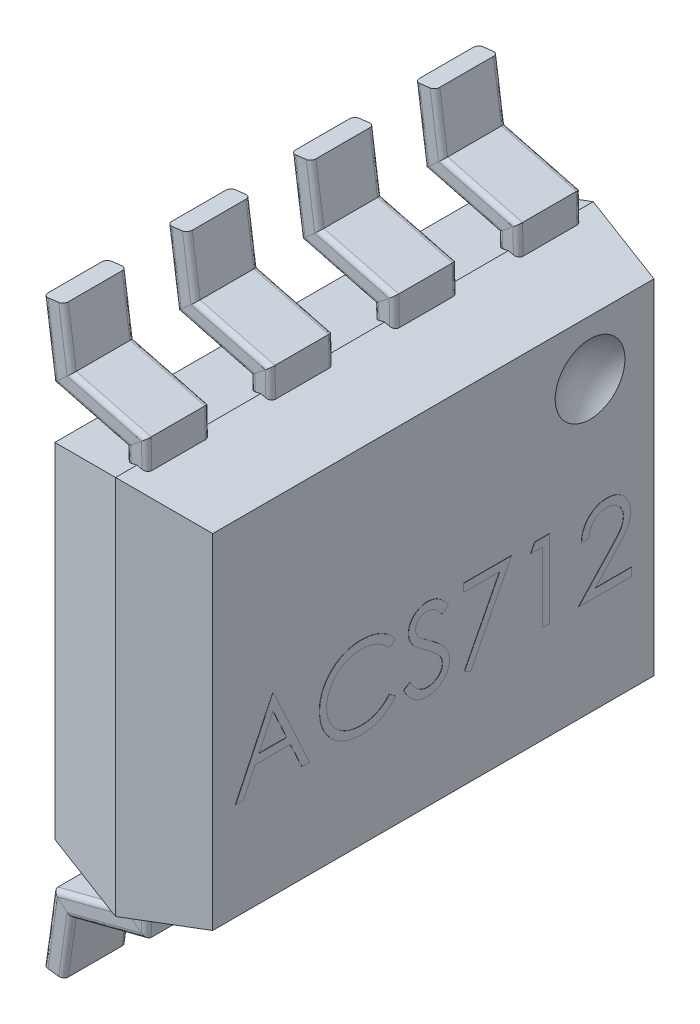
from build123d import *

# Parameters (mm, degrees)
SKETCH1_W                     = 4.9
SKETCH1_H                     = 3.9
BOSS_EXTRUDE1_DEPTH           = 0.81
BOSS_EXTRUDE1_TAPER           = 13
BOSS_EXTRUDE1_OTHER_WAY_DEPTH = 0.81
BOSS_EXTRUDE1_OTHER_WAY_TAPER = 13
LPATTERN1_COUNT               = 4
LPATTERN1_PITCH               = 1.27
BOSS_EXTRUDE2_DEPTH           = 0.0025


with BuildPart() as part:
    # Sketch1 → Boss-Extrude1 (new body)
    with BuildSketch(Plane(origin=(0, 0, 0), x_dir=(0, 0, -1), z_dir=(1, 0, 0))):
        Rectangle(SKETCH1_W, SKETCH1_H)
    extrude(amount=BOSS_EXTRUDE1_DEPTH, taper=BOSS_EXTRUDE1_TAPER)

    # Sketch1 → Boss-Extrude1 other way (add)
    with BuildSketch(Plane(origin=(0, 0, 0), x_dir=(0, 0, -1), z_dir=(1, 0, 0))):
        Rectangle(SKETCH1_W, SKETCH1_H)
    extrude(amount=-BOSS_EXTRUDE1_OTHER_WAY_DEPTH, taper=BOSS_EXTRUDE1_OTHER_WAY_TAPER)

    # Sweep1: sweep along a path in Sketch3
    with BuildLine(Plane.XY.offset(1.91)) as sweep1_path:
        Line((0.007954045, -1.762996765), (0, -2.147914592))
        Line((0, -2.147914592), (-0.759438706, -2.343537501))
        Line((-0.759438706, -2.343537501), (-0.85, -2.987914592))
    # Sketch2 → Sweep1 (sweep)
    with BuildSketch(Plane(origin=(0, -1.762996765, 0), x_dir=(-1, 0, 0), z_dir=(0, -1, 0))):
        with BuildLine():
            Line((0.055, -2.23), (-0.055, -2.23))
            ThreePointArc((-0.055, -2.23), (-0.090355339, -2.215355339), (-0.105, -2.18))
            Line((-0.105, -2.18), (-0.105, -1.63))
            ThreePointArc((-0.105, -1.63), (-0.090355339, -1.594644661), (-0.055, -1.58))
            Line((-0.055, -1.58), (0.055, -1.58))
            ThreePointArc((0.055, -1.58), (0.090355339, -1.594644661), (0.105, -1.63))
            Line((0.105, -1.63), (0.105, -2.18))
            ThreePointArc((0.105, -2.18), (0.090355339, -2.215355339), (0.055, -2.23))
        make_face()
    sweep1 = sweep(path=sweep1_path.line, transition=Transition.RIGHT)

    # LPattern1: Sweep1 ×4
    with Locations(*[(0, 0, -i * LPATTERN1_PITCH) for i in range(1, LPATTERN1_COUNT)]):
        add(sweep1)

    # Mirror1: Sweep1 across plane
    add(sweep1.mirror(Plane.ZX))

    # Mirror1 copy 1: sweep along a path in Mirror1 copy 1 path
    with BuildLine(Plane.XY.offset(0.64)) as mirror1_copy_1_path:
        Line((0.007954045, 1.762996765), (0, 2.147914592))
        Line((0, 2.147914592), (-0.759438706, 2.343537501))
        Line((-0.759438706, 2.343537501), (-0.85, 2.987914592))
    # Mirror1 copy 1 sketch → Mirror1 copy 1 (sweep)
    with BuildSketch(Plane(origin=(0, 1.762996765, -1.27), x_dir=(-1, 0, 0), z_dir=(0, 1, 0))):
        with BuildLine():
            Line((0.055, 2.23), (-0.055, 2.23))
            ThreePointArc((-0.055, 2.23), (-0.090355339, 2.215355339), (-0.105, 2.18))
            Line((-0.105, 2.18), (-0.105, 1.63))
            ThreePointArc((-0.105, 1.63), (-0.090355339, 1.594644661), (-0.055, 1.58))
            Line((-0.055, 1.58), (0.055, 1.58))
            ThreePointArc((0.055, 1.58), (0.090355339, 1.594644661), (0.105, 1.63))
            Line((0.105, 1.63), (0.105, 2.18))
            ThreePointArc((0.105, 2.18), (0.090355339, 2.215355339), (0.055, 2.23))
        make_face()
    sweep(path=mirror1_copy_1_path.line, transition=Transition.RIGHT)

    # Mirror1 copy 2: sweep along a path in Mirror1 copy 2 path
    with BuildLine(Plane.XY.offset(-0.63)) as mirror1_copy_2_path:
        Line((0.007954045, 1.762996765), (0, 2.147914592))
        Line((0, 2.147914592), (-0.759438706, 2.343537501))
        Line((-0.759438706, 2.343537501), (-0.85, 2.987914592))
    # Mirror1 copy 2 sketch → Mirror1 copy 2 (sweep)
    with BuildSketch(Plane(origin=(0, 1.762996765, -2.54), x_dir=(-1, 0, 0), z_dir=(0, 1, 0))):
        with BuildLine():
            Line((0.055, 2.23), (-0.055, 2.23))
            ThreePointArc((-0.055, 2.23), (-0.090355339, 2.215355339), (-0.105, 2.18))
            Line((-0.105, 2.18), (-0.105, 1.63))
            ThreePointArc((-0.105, 1.63), (-0.090355339, 1.594644661), (-0.055, 1.58))
            Line((-0.055, 1.58), (0.055, 1.58))
            ThreePointArc((0.055, 1.58), (0.090355339, 1.594644661), (0.105, 1.63))
            Line((0.105, 1.63), (0.105, 2.18))
            ThreePointArc((0.105, 2.18), (0.090355339, 2.215355339), (0.055, 2.23))
        make_face()
    sweep(path=mirror1_copy_2_path.line, transition=Transition.RIGHT)

    # Mirror1 copy 3: sweep along a path in Mirror1 copy 3 path
    with BuildLine(Plane.XY.offset(-1.9)) as mirror1_copy_3_path:
        Line((0.007954045, 1.762996765), (0, 2.147914592))
        Line((0, 2.147914592), (-0.759438706, 2.343537501))
        Line((-0.759438706, 2.343537501), (-0.85, 2.987914592))
    # Mirror1 copy 3 sketch → Mirror1 copy 3 (sweep)
    with BuildSketch(Plane(origin=(0, 1.762996765, -3.81), x_dir=(-1, 0, 0), z_dir=(0, 1, 0))):
        with BuildLine():
            Line((0.055, 2.23), (-0.055, 2.23))
            ThreePointArc((-0.055, 2.23), (-0.090355339, 2.215355339), (-0.105, 2.18))
            Line((-0.105, 2.18), (-0.105, 1.63))
            ThreePointArc((-0.105, 1.63), (-0.090355339, 1.594644661), (-0.055, 1.58))
            Line((-0.055, 1.58), (0.055, 1.58))
            ThreePointArc((0.055, 1.58), (0.090355339, 1.594644661), (0.105, 1.63))
            Line((0.105, 1.63), (0.105, 2.18))
            ThreePointArc((0.105, 2.18), (0.090355339, 2.215355339), (0.055, 2.23))
        make_face()
    sweep(path=mirror1_copy_3_path.line, transition=Transition.RIGHT)

    # Sketch12 → Cut-Revolve1 (revolve, cut)
    with BuildSketch(Plane(origin=(0, 1.2, 0), x_dir=(1, 0, 0), z_dir=(0, 1, 0))):
        with BuildLine():
            Line((0.81, 1.96553499), (0.857828021, 1.96553499))
            Line((0.857828021, 1.96553499), (0.857828021, 1.607656851))
            Line((0.857828021, 1.607656851), (0.661762021, 1.607656851))
            ThreePointArc((0.661762021, 1.607656851), (0.701899104, 1.800671687), (0.81, 1.96553499))
        make_face()
    revolve(axis=Axis((0.905576276, 1.2, -1.607656851), (-1, 0, 0)), mode=Mode.SUBTRACT)

    # Sketch14 → Boss-Extrude2 (add)
    # profile 1 of 6: a face of its own
    with BuildSketch(Plane(origin=(0.81, 0, 0), x_dir=(0, 0, -1), z_dir=(1, 0, 0))):
        Polygon((-1.641025641, 0.037003235), (-1.271794872, -0.762996765), (-1.349839744, -0.762996765), (-1.468108974, -0.506586509), (-1.830769231, -0.506586509), (-1.952403846, -0.762996765), (-2.030769231, -0.762996765), (-1.651282051, 0.037003235), align=None)
        Polygon((-1.646955128, -0.118926252), (-1.791826923, -0.424535227), (-1.505929487, -0.424535227), align=None, mode=Mode.SUBTRACT)
    # profile 2 of 6: a face of its own
    with BuildSketch(Plane(origin=(0.81, 0, 0), x_dir=(0, 0, -1), z_dir=(1, 0, 0))):
        with BuildLine():
            Line((-0.38974359, -0.109791637), (-0.452564103, -0.15786856))
            add(Edge.make_bspline(
                [(-0.452564103, -0.15786856), (-0.457045448, -0.152527767), (-0.465947722, -0.141918186), (-0.480269825, -0.127020005), (-0.495195915, -0.113062231), (-0.510720286, -0.099978372), (-0.52712237, -0.088225969), (-0.544004839, -0.077192574), (-0.561650106, -0.067302805), (-0.586050503, -0.055311265), (-0.617970011, -0.042797859), (-0.658151688, -0.032305691), (-0.700097082, -0.025626566), (-0.728713676, -0.024903173), (-0.743269231, -0.024535227)],
                knots=[0, 0, 0, 0, 0.757959112, 1.505699292, 2.245454638, 2.979532153, 3.711538275, 4.438200793, 5.171680507, 5.909471876, 7.393775596, 8.890124382, 10.418191784, 12, 12, 12, 12], degree=3))
            add(Edge.make_bspline(
                [(-0.743269231, -0.024535227), (-0.751288271, -0.024627561), (-0.767251926, -0.024811373), (-0.790943006, -0.027236316), (-0.814191703, -0.030644592), (-0.836982895, -0.035701809), (-0.859287572, -0.04209555), (-0.881251549, -0.049735645), (-0.902556829, -0.05918818), (-0.923498141, -0.069635782), (-0.94356196, -0.081436341), (-0.962545971, -0.094307964), (-0.980380935, -0.108106615), (-0.997080961, -0.122884011), (-1.012663121, -0.138573601), (-1.027014506, -0.155342594), (-1.040085457, -0.173137376), (-1.052135063, -0.191723298), (-1.062926545, -0.211046222), (-1.071961946, -0.231177667), (-1.079963116, -0.25177289), (-1.086294372, -0.273064584), (-1.09130569, -0.294902931), (-1.094763442, -0.317346539), (-1.097160806, -0.340348523), (-1.097343704, -0.355939223), (-1.097435897, -0.363798047)],
                knots=[0, 0, 0, 0, 1.054917814, 2.100044995, 3.131103042, 4.146048494, 5.169673617, 6.183595914, 7.203665975, 8.234915748, 9.262203917, 10.264457458, 11.251630812, 12.227803204, 13.197192746, 14.159520551, 15.12972552, 16.100847026, 17.073214652, 18.039054194, 19.002613845, 19.979014051, 20.95965708, 21.949030935, 22.966165397, 24, 24, 24, 24], degree=3))
            add(Edge.make_bspline(
                [(-1.097435897, -0.363798047), (-1.097147482, -0.375622349), (-1.096581216, -0.398837797), (-1.091541596, -0.432842508), (-1.08388329, -0.465418662), (-1.072405444, -0.496362626), (-1.058252518, -0.526055965), (-1.040368949, -0.553996274), (-1.019656598, -0.580605775), (-0.995822445, -0.605255591), (-0.969672544, -0.627773014), (-0.941615879, -0.647601719), (-0.911722327, -0.664130835), (-0.880321955, -0.677885337), (-0.847173129, -0.688458303), (-0.812335459, -0.695901531), (-0.775884718, -0.700756887), (-0.750977426, -0.70122173), (-0.738301282, -0.701458304)],
                knots=[0, 0, 0, 0, 1.029171465, 2.020641659, 2.987623507, 3.938342917, 4.889210282, 5.84687017, 6.821220943, 7.821438502, 8.827599549, 9.822697543, 10.807740252, 11.797342354, 12.80366471, 13.83203677, 14.896651826, 16, 16, 16, 16], degree=3))
            add(Edge.make_bspline(
                [(-0.738301282, -0.701458304), (-0.724334953, -0.701072297), (-0.696845877, -0.700312543), (-0.656533185, -0.693876143), (-0.617942153, -0.683440048), (-0.581070705, -0.668834808), (-0.546022785, -0.649848457), (-0.512743549, -0.626831799), (-0.481204904, -0.599565895), (-0.46224004, -0.578746894), (-0.452564103, -0.56812497)],
                knots=[0, 0, 0, 0, 1.028121516, 2.023589091, 2.998037872, 3.967518031, 4.937445131, 5.927275754, 6.942489185, 8, 8, 8, 8], degree=3))
            Line((-0.452564103, -0.56812497), (-0.38974359, -0.615721124))
            add(Edge.make_bspline(
                [(-0.38974359, -0.615721124), (-0.394799158, -0.622244199), (-0.404886078, -0.635259103), (-0.421219339, -0.653606923), (-0.438425578, -0.670864988), (-0.456632598, -0.686894158), (-0.47563095, -0.702015179), (-0.495761764, -0.715798455), (-0.5167604, -0.728436371), (-0.53855571, -0.74000824), (-0.561124535, -0.750275039), (-0.584439835, -0.759064472), (-0.608401109, -0.766635875), (-0.633009454, -0.772864889), (-0.658315913, -0.777726851), (-0.684229164, -0.780977062), (-0.710805135, -0.783203786), (-0.728734603, -0.783406738), (-0.737820513, -0.783509586)],
                knots=[0, 0, 0, 0, 0.986787822, 1.968848986, 2.935600012, 3.899624008, 4.868462664, 5.837806735, 6.815139263, 7.798259679, 8.787526145, 9.778297419, 10.776456485, 11.791383307, 12.812564526, 13.85620153, 14.913611965, 16, 16, 16, 16], degree=3))
            add(Edge.make_bspline(
                [(-0.737820513, -0.783509586), (-0.74642478, -0.783449702), (-0.763438652, -0.783331288), (-0.788558366, -0.781413079), (-0.813013128, -0.778795996), (-0.836733042, -0.774855395), (-0.859847551, -0.77020526), (-0.882147113, -0.76397183), (-0.903851161, -0.756989163), (-0.924872496, -0.748782309), (-0.945228999, -0.739521467), (-0.964855013, -0.729054825), (-0.983741512, -0.717470399), (-1.002074179, -0.705023539), (-1.019582198, -0.691314442), (-1.03641729, -0.676533497), (-1.052673856, -0.660730523), (-1.062731612, -0.649335128), (-1.067788462, -0.64360574)],
                knots=[0, 0, 0, 0, 1.114604814, 2.203992996, 3.262667896, 4.300477797, 5.318619304, 6.316056647, 7.298880507, 8.271930387, 9.238335007, 10.195173496, 11.151986948, 12.108099108, 13.064862484, 14.031167946, 15.010108607, 16, 16, 16, 16], degree=3))
            add(Edge.make_bspline(
                [(-1.067788462, -0.64360574), (-1.075888037, -0.633653468), (-1.091989403, -0.613869077), (-1.11258956, -0.58180371), (-1.130223286, -0.548325262), (-1.14448064, -0.51325785), (-1.155626407, -0.476680161), (-1.163347823, -0.438573758), (-1.168365333, -0.398974228), (-1.168939113, -0.372040105), (-1.169230769, -0.358349329)],
                knots=[0, 0, 0, 0, 0.994628077, 1.977248131, 2.950237994, 3.925870899, 4.908910175, 5.911660606, 6.938484602, 8, 8, 8, 8], degree=3))
            add(Edge.make_bspline(
                [(-1.169230769, -0.358349329), (-1.168875296, -0.343959511), (-1.168175926, -0.315648443), (-1.16223403, -0.274100111), (-1.152675448, -0.234294077), (-1.139099016, -0.196304649), (-1.121886364, -0.159932014), (-1.100623138, -0.125454024), (-1.075556363, -0.092650184), (-1.046882633, -0.062018241), (-1.015438671, -0.034009246), (-0.981765799, -0.009367828), (-0.945929926, 0.011139033), (-0.908325845, 0.028281013), (-0.868671975, 0.04145689), (-0.827052919, 0.050680475), (-0.783546882, 0.056421531), (-0.753864041, 0.057147292), (-0.738782051, 0.057516055)],
                knots=[0, 0, 0, 0, 1.032925535, 2.032216505, 3.007276963, 3.968222605, 4.92396291, 5.891752235, 6.871517503, 7.883894988, 8.900124299, 9.891468569, 10.874487609, 11.85992873, 12.854644235, 13.869047385, 14.917252991, 16, 16, 16, 16], degree=3))
            add(Edge.make_bspline(
                [(-0.738782051, 0.057516055), (-0.729590172, 0.057405852), (-0.711395773, 0.057187717), (-0.684480881, 0.055060598), (-0.65827692, 0.051514631), (-0.632765839, 0.046688101), (-0.607823526, 0.040697856), (-0.583640614, 0.032894359), (-0.5600752, 0.023971724), (-0.537275907, 0.013695503), (-0.515352124, 0.002160248), (-0.49431068, -0.010506181), (-0.474318712, -0.024288079), (-0.455235546, -0.039068233), (-0.437380413, -0.055159333), (-0.42024636, -0.072118783), (-0.404415257, -0.090435086), (-0.394643098, -0.103327642), (-0.38974359, -0.109791637)],
                knots=[0, 0, 0, 0, 1.096760587, 2.17092713, 3.219439832, 4.250915756, 5.268269357, 6.278326846, 7.281116186, 8.274029601, 9.260640565, 10.235837813, 11.203064059, 12.156899882, 13.114053108, 14.069676657, 15.032185724, 16, 16, 16, 16], degree=3))
        make_face()
    # profile 3 of 6: a face of its own
    with BuildSketch(Plane(origin=(0.81, 0, 0), x_dir=(0, 0, -1), z_dir=(1, 0, 0))):
        with BuildLine():
            Line((-0.307692308, -0.608669842), (-0.240064103, -0.56812497))
            add(Edge.make_bspline(
                [(-0.240064103, -0.56812497), (-0.23377422, -0.578653973), (-0.221723047, -0.598827135), (-0.201619879, -0.626086115), (-0.1807895, -0.649254608), (-0.159077652, -0.668197833), (-0.136616864, -0.683111864), (-0.113260509, -0.693672374), (-0.089087295, -0.700258883), (-0.072636136, -0.701058903), (-0.064423077, -0.701458304)],
                knots=[0, 0, 0, 0, 1.272034388, 2.437168799, 3.508375237, 4.49857839, 5.41946034, 6.295179144, 7.148887113, 8, 8, 8, 8], degree=3))
            add(Edge.make_bspline(
                [(-0.064423077, -0.701458304), (-0.057408937, -0.70126295), (-0.043503389, -0.700875661), (-0.023032019, -0.697154335), (-0.003150465, -0.691437277), (0.01573151, -0.683249635), (0.033353364, -0.673343695), (0.048806323, -0.661378855), (0.062165435, -0.647983151), (0.073093233, -0.633038544), (0.081477241, -0.616966053), (0.087921142, -0.600468693), (0.091497159, -0.583287305), (0.092035845, -0.5717192), (0.092307692, -0.565881381)],
                knots=[0, 0, 0, 0, 1.095163259, 2.171163733, 3.241058638, 4.321873601, 5.38011039, 6.391990106, 7.366004449, 8.327778327, 9.272591725, 10.192022065, 11.087607919, 12, 12, 12, 12], degree=3))
            add(Edge.make_bspline(
                [(0.092307692, -0.565881381), (0.091970707, -0.559220615), (0.091285665, -0.545680252), (0.085495613, -0.525703188), (0.076387213, -0.505933458), (0.067984323, -0.493704597), (0.063621795, -0.48735574)],
                knots=[0, 0, 0, 0, 0.938893495, 1.908633276, 2.914225137, 4, 4, 4, 4], degree=3))
            add(Edge.make_bspline(
                [(0.063621795, -0.48735574), (0.06003994, -0.482773608), (0.052520284, -0.473153997), (0.039592853, -0.458835086), (0.024423455, -0.444065162), (0.007531214, -0.428280235), (-0.011699206, -0.412214453), (-0.032665495, -0.395101703), (-0.055902949, -0.377592771), (-0.072199976, -0.365850471), (-0.080608974, -0.359791637)],
                knots=[0, 0, 0, 0, 0.722233717, 1.516239348, 2.393582979, 3.351407094, 4.387010283, 5.505090956, 6.712668013, 8, 8, 8, 8], degree=3))
            add(Edge.make_bspline(
                [(-0.080608974, -0.359791637), (-0.089025888, -0.353796531), (-0.105118385, -0.342334346), (-0.127623204, -0.325323081), (-0.147747653, -0.309770196), (-0.165402285, -0.295529279), (-0.180579336, -0.282598398), (-0.193398401, -0.271101726), (-0.203532929, -0.260728341), (-0.20916849, -0.253998891), (-0.211698718, -0.250977534)],
                knots=[0, 0, 0, 0, 1.452282411, 2.77665338, 3.964542531, 5.026858415, 5.96415736, 6.766646006, 7.446254459, 8, 8, 8, 8], degree=3))
            add(Edge.make_bspline(
                [(-0.211698718, -0.250977534), (-0.2152353, -0.246268726), (-0.222190462, -0.237008222), (-0.231371264, -0.222533969), (-0.239174501, -0.207717223), (-0.245291605, -0.192518168), (-0.250442741, -0.177150184), (-0.253907411, -0.161412757), (-0.256076873, -0.145376501), (-0.256299041, -0.134584844), (-0.256410256, -0.129182663)],
                knots=[0, 0, 0, 0, 1.068054152, 2.10047183, 3.106115577, 4.101338837, 5.06977816, 6.043150881, 7.020423561, 8, 8, 8, 8], degree=3))
            add(Edge.make_bspline(
                [(-0.256410256, -0.129182663), (-0.256111923, -0.120718714), (-0.255521633, -0.103971728), (-0.250529514, -0.079507538), (-0.242649996, -0.056150643), (-0.231611164, -0.034132281), (-0.217380912, -0.014025771), (-0.200913261, 0.004400169), (-0.181299207, 0.01989013), (-0.159778607, 0.033424315), (-0.136222865, 0.04401767), (-0.11153923, 0.052008751), (-0.085688471, 0.056536581), (-0.068179183, 0.057186356), (-0.059294872, 0.057516055)],
                knots=[0, 0, 0, 0, 1.005424448, 1.989358655, 2.955360095, 3.929531133, 4.905563448, 5.876582895, 6.856512386, 7.866279853, 8.892233794, 9.918561126, 10.94386622, 12, 12, 12, 12], degree=3))
            add(Edge.make_bspline(
                [(-0.059294872, 0.057516055), (-0.049867649, 0.057190901), (-0.031119911, 0.056544272), (-0.003542948, 0.050921979), (0.023008073, 0.041618968), (0.044366534, 0.031061561), (0.061082593, 0.020517237), (0.073830647, 0.010912706), (0.086748921, -0.000144462), (0.099941619, -0.012683718), (0.113185199, -0.026820118), (0.126676273, -0.042456847), (0.140446392, -0.059498346), (0.149304874, -0.071663946), (0.153846154, -0.077900611)],
                knots=[0, 0, 0, 0, 1.286793592, 2.559021753, 3.825965368, 5.121522368, 5.803751409, 6.523245864, 7.299691795, 8.125521123, 9.008227632, 9.944561021, 10.946284179, 12, 12, 12, 12], degree=3))
            Line((0.153846154, -0.077900611), (0.088942308, -0.127099329))
            add(Edge.make_bspline(
                [(0.088942308, -0.127099329), (0.085023237, -0.122050486), (0.077476024, -0.112327594), (0.066017856, -0.098711293), (0.055218165, -0.08627324), (0.044578074, -0.075469783), (0.034659529, -0.065709295), (0.025032777, -0.057352779), (0.015836354, -0.050318357), (0.004243917, -0.042811258), (-0.010320133, -0.035369771), (-0.028602313, -0.029072839), (-0.047707747, -0.025288825), (-0.060720234, -0.024788508), (-0.067307692, -0.024535227)],
                knots=[0, 0, 0, 0, 1.181633172, 2.275549214, 3.290209073, 4.226197932, 5.078386478, 5.862611352, 6.581680152, 7.217281963, 8.414376989, 9.595101626, 10.782541182, 12, 12, 12, 12], degree=3))
            add(Edge.make_bspline(
                [(-0.067307692, -0.024535227), (-0.07557204, -0.024812187), (-0.091509057, -0.025346278), (-0.114135397, -0.031179417), (-0.134499722, -0.040363843), (-0.151997451, -0.053235838), (-0.166565903, -0.06848635), (-0.177104294, -0.086035803), (-0.183447189, -0.105414638), (-0.184221195, -0.118932731), (-0.184615385, -0.125817278)],
                knots=[0, 0, 0, 0, 1.14458467, 2.207223713, 3.21896685, 4.227309161, 5.202851033, 6.127160689, 7.046193047, 8, 8, 8, 8], degree=3))
            add(Edge.make_bspline(
                [(-0.184615385, -0.125817278), (-0.184525527, -0.13010333), (-0.184345665, -0.138682443), (-0.18183714, -0.151357054), (-0.178614436, -0.163999646), (-0.173507549, -0.176553379), (-0.166457194, -0.189237804), (-0.157198868, -0.202271344), (-0.145538682, -0.215768877), (-0.136606794, -0.224547706), (-0.131891026, -0.229182663)],
                knots=[0, 0, 0, 0, 0.858281714, 1.717966888, 2.583508476, 3.4729293, 4.427298488, 5.488583878, 6.674047936, 8, 8, 8, 8], degree=3))
            add(Edge.make_bspline(
                [(-0.131891026, -0.229182663), (-0.130139855, -0.230745411), (-0.125979474, -0.234458145), (-0.118373548, -0.24053638), (-0.10832948, -0.248034157), (-0.096109548, -0.257311258), (-0.081488437, -0.268072735), (-0.064464538, -0.280180989), (-0.045227616, -0.294029094), (-0.031576893, -0.303710817), (-0.024358974, -0.308830099)],
                knots=[0, 0, 0, 0, 0.420754252, 0.999615792, 1.744751191, 2.668019286, 3.750313428, 4.999500688, 6.413464383, 8, 8, 8, 8], degree=3))
            add(Edge.make_bspline(
                [(-0.024358974, -0.308830099), (-0.01567648, -0.315148124), (0.001135967, -0.327382103), (0.0250577, -0.34576283), (0.046747713, -0.363739463), (0.06628216, -0.381197202), (0.083854024, -0.398003623), (0.099268361, -0.414360921), (0.11268223, -0.430151909), (0.127123195, -0.45039707), (0.141879268, -0.475261317), (0.154551612, -0.505724915), (0.162542092, -0.536306931), (0.163587009, -0.556861636), (0.164102564, -0.567003175)],
                knots=[0, 0, 0, 0, 1.163667725, 2.253281268, 3.268753668, 4.215851969, 5.092017293, 5.902905408, 6.650798638, 7.335211899, 8.59617414, 9.77448103, 10.901945474, 12, 12, 12, 12], degree=3))
            add(Edge.make_bspline(
                [(0.164102564, -0.567003175), (0.163952361, -0.574175373), (0.163654872, -0.588380489), (0.160235235, -0.609238793), (0.155225025, -0.629497277), (0.147673658, -0.648905531), (0.138456936, -0.66781862), (0.126761793, -0.685740426), (0.113205751, -0.703067603), (0.097655176, -0.719338115), (0.08063897, -0.734274388), (0.062654126, -0.747561031), (0.043671206, -0.758639505), (0.023793191, -0.767679697), (0.003015514, -0.774750216), (-0.018654837, -0.779873157), (-0.041253582, -0.78301732), (-0.056613692, -0.783343665), (-0.064423077, -0.783509586)],
                knots=[0, 0, 0, 0, 0.983748083, 1.948392443, 2.894712957, 3.844097841, 4.80183111, 5.778335162, 6.776009319, 7.81870978, 8.863265674, 9.881300176, 10.883814829, 11.87499822, 12.874611388, 13.892143829, 14.928324115, 16, 16, 16, 16], degree=3))
            add(Edge.make_bspline(
                [(-0.064423077, -0.783509586), (-0.070465441, -0.783392744), (-0.082474072, -0.783160533), (-0.100236239, -0.781107669), (-0.117639574, -0.778203188), (-0.134465695, -0.773591972), (-0.15093139, -0.767997234), (-0.166965043, -0.761108472), (-0.182574427, -0.752853112), (-0.197847017, -0.743414249), (-0.212743971, -0.732429622), (-0.227125564, -0.71963568), (-0.241463664, -0.705385279), (-0.255335069, -0.689291436), (-0.269020359, -0.67161416), (-0.282249709, -0.652188061), (-0.295296959, -0.631118951), (-0.303483352, -0.616292646), (-0.307692308, -0.608669842)],
                knots=[0, 0, 0, 0, 0.915332311, 1.819136955, 2.706846663, 3.586547465, 4.459518054, 5.340707479, 6.227863349, 7.133153174, 8.059268498, 9.028702269, 10.047606654, 11.120612155, 12.245963614, 13.433783089, 14.680604001, 16, 16, 16, 16], degree=3))
        make_face()
    # profile 4 of 6: a face of its own
    with BuildSketch(Plane(origin=(0.81, 0, 0), x_dir=(0, 0, -1), z_dir=(1, 0, 0))):
        Polygon((0.307692308, 0.037003235), (0.8, 0.037003235), (0.379487179, -0.783509586), (0.317467949, -0.74937497), (0.678525641, -0.045048047), (0.307692308, -0.045048047), align=None)
    # profile 5 of 6: a face of its own
    with BuildSketch(Plane(origin=(0.81, 0, 0), x_dir=(0, 0, -1), z_dir=(1, 0, 0))):
        Polygon((1.041826923, 0.037003235), (1.18974359, 0.037003235), (1.18974359, -0.762996765), (1.117948718, -0.762996765), (1.117948718, -0.045048047), (0.994871795, -0.045048047), align=None)
    # profile 6 of 6: a face of its own
    with BuildSketch(Plane(origin=(0.81, 0, 0), x_dir=(0, 0, -1), z_dir=(1, 0, 0))):
        with BuildLine():
            Line((1.58974359, -0.209150611), (1.517948718, -0.209150611))
            add(Edge.make_bspline(
                [(1.517948718, -0.209150611), (1.518416639, -0.199625837), (1.519335622, -0.180919434), (1.523639231, -0.153645398), (1.529797146, -0.12757573), (1.538503764, -0.102919749), (1.549316628, -0.079459451), (1.562283491, -0.057288018), (1.577642086, -0.036490032), (1.595060768, -0.017258297), (1.613979314, 0.000384577), (1.6343921, 0.015620061), (1.655842392, 0.028492671), (1.678265112, 0.039254098), (1.70191324, 0.047331777), (1.726572179, 0.053325295), (1.752350268, 0.056931317), (1.769913701, 0.057318925), (1.778846154, 0.057516055)],
                knots=[0, 0, 0, 0, 1.10065271, 2.161652631, 3.183658789, 4.190468796, 5.17591951, 6.163126047, 7.15150782, 8.156236427, 9.156009102, 10.134482811, 11.092018607, 12.041330605, 13.001268258, 13.972401359, 14.968799086, 16, 16, 16, 16], degree=3))
            add(Edge.make_bspline(
                [(1.778846154, 0.057516055), (1.787618285, 0.057310694), (1.80485521, 0.056907166), (1.830012241, 0.053441788), (1.853961337, 0.048014224), (1.876655684, 0.040399272), (1.897914213, 0.030162831), (1.917896623, 0.017866251), (1.936840808, 0.003644575), (1.953893788, -0.013099154), (1.969552777, -0.030973984), (1.983061864, -0.050056934), (1.994630587, -0.069766485), (2.004273485, -0.090252931), (2.011372031, -0.111709166), (2.016761336, -0.133822812), (2.019807602, -0.156822769), (2.020275127, -0.172389982), (2.020512821, -0.180304457)],
                knots=[0, 0, 0, 0, 1.111607364, 2.184268762, 3.212621178, 4.221274766, 5.211760367, 6.196651075, 7.1921475, 8.207485113, 9.220403448, 10.201281604, 11.166441695, 12.114753415, 13.065576456, 14.026450734, 14.996634279, 16, 16, 16, 16], degree=3))
            add(Edge.make_bspline(
                [(2.020512821, -0.180304457), (2.020125789, -0.19144682), (2.019358518, -0.213536011), (2.012795232, -0.245996551), (2.002544601, -0.277446476), (1.990202348, -0.302757859), (1.977751503, -0.323154086), (1.966531502, -0.339946933), (1.953396688, -0.358028183), (1.938155888, -0.377337289), (1.921124374, -0.398025496), (1.90214788, -0.420080306), (1.881091084, -0.443273853), (1.866311998, -0.459115134), (1.858653846, -0.467323688)],
                knots=[0, 0, 0, 0, 1.184426356, 2.348067706, 3.509069118, 4.696110526, 5.333549288, 6.050745305, 6.844228056, 7.710549037, 8.667450064, 9.695053472, 10.805634456, 12, 12, 12, 12], degree=3))
            Line((1.858653846, -0.467323688), (1.65849359, -0.680945483))
            Line((1.65849359, -0.680945483), (2.030769231, -0.680945483))
            Line((2.030769231, -0.680945483), (2.030769231, -0.762996765))
            Line((2.030769231, -0.762996765), (1.487179487, -0.762996765))
            Line((1.487179487, -0.762996765), (1.797435897, -0.431907022))
            add(Edge.make_bspline(
                [(1.797435897, -0.431907022), (1.8049897, -0.424021694), (1.819499009, -0.408875595), (1.840020741, -0.386762918), (1.85845251, -0.366248737), (1.874913628, -0.347371812), (1.889047001, -0.329856025), (1.901589225, -0.314268664), (1.911638503, -0.29992479), (1.922544879, -0.283298364), (1.933108075, -0.262998406), (1.942185185, -0.238190705), (1.947720008, -0.212653047), (1.94838397, -0.195395439), (1.948717949, -0.186714714)],
                knots=[0, 0, 0, 0, 1.329631726, 2.553950428, 3.673215718, 4.687767853, 5.603093632, 6.413772471, 7.123043292, 7.734684054, 8.834405432, 9.900288307, 10.943827018, 12, 12, 12, 12], degree=3))
            add(Edge.make_bspline(
                [(1.948717949, -0.186714714), (1.948572636, -0.181256109), (1.948286253, -0.170498246), (1.945758779, -0.154725501), (1.941939235, -0.139510686), (1.936466033, -0.124807002), (1.929241636, -0.110762281), (1.92044772, -0.097359429), (1.91030142, -0.084401951), (1.898563987, -0.072252626), (1.885669925, -0.061125493), (1.872048383, -0.051268559), (1.85763693, -0.043031048), (1.842496331, -0.036278249), (1.826668795, -0.030981019), (1.81012371, -0.027310486), (1.792906792, -0.025005919), (1.781150565, -0.024694108), (1.775160256, -0.024535227)],
                knots=[0, 0, 0, 0, 0.991446411, 1.95395049, 2.89581595, 3.838931463, 4.798493298, 5.75982156, 6.748411868, 7.785213223, 8.824556874, 9.840280684, 10.836137867, 11.835679398, 12.848801643, 13.863922112, 14.911575587, 16, 16, 16, 16], degree=3))
            add(Edge.make_bspline(
                [(1.775160256, -0.024535227), (1.768904066, -0.024698663), (1.756617941, -0.025019624), (1.738579305, -0.027264804), (1.721371127, -0.031138139), (1.704950121, -0.036435665), (1.689288501, -0.043169047), (1.674462434, -0.051555732), (1.660505202, -0.061563387), (1.647390568, -0.0729098), (1.635307373, -0.085542395), (1.624690944, -0.099624672), (1.615414598, -0.11489951), (1.607321059, -0.131325693), (1.60074833, -0.149052271), (1.595725896, -0.168016318), (1.591751759, -0.188135491), (1.590424097, -0.202029225), (1.58974359, -0.209150611)],
                knots=[0, 0, 0, 0, 1.031018746, 2.02475058, 2.990194455, 3.934040569, 4.864654155, 5.795059489, 6.735614925, 7.690564532, 8.649604399, 9.611025574, 10.590972636, 11.591080095, 12.624614302, 13.701020113, 14.821632451, 16, 16, 16, 16], degree=3))
        make_face()
    extrude(amount=BOSS_EXTRUDE2_DEPTH)


solid = part.part
